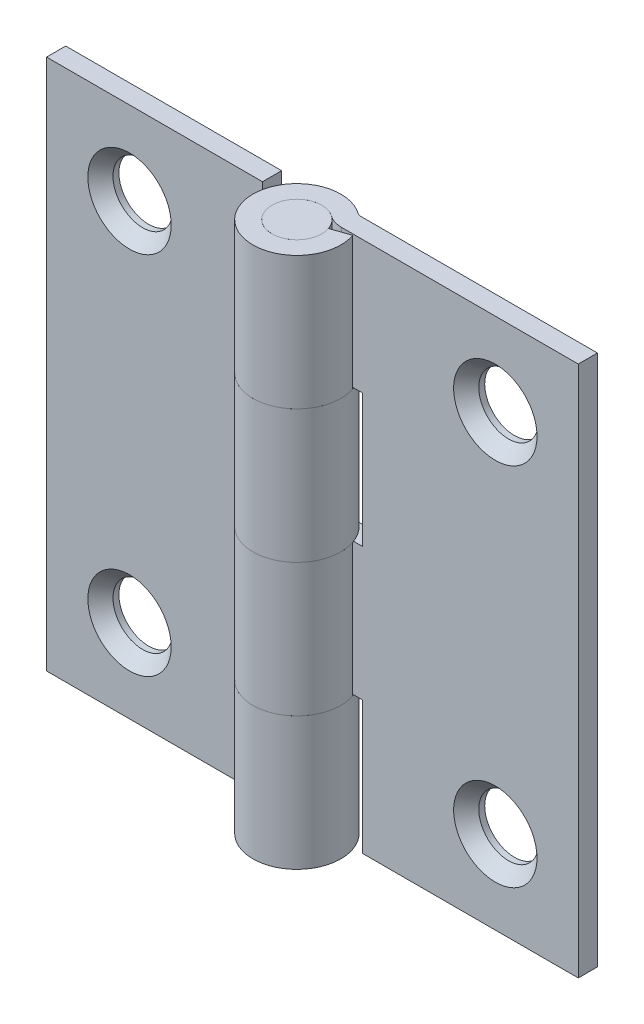
from build123d import *

# Parameters (mm, degrees)
EXTRUDE_THIN1_DEPTH      = 25.4
EXTRUDE_THIN1_DEPTH_BACK = 25.4
EXTRUDE_THIN2_DEPTH      = 25.4
EXTRUDE_THIN2_DEPTH_BACK = 25.4
CUT_EXTRUDE1_START       = -12.7
CUT_EXTRUDE1_DEPTH       = 12.7
LPATTERN1_COUNT          = 2
LPATTERN1_PITCH          = 25.4
CUT_EXTRUDE2_START       = -25.4
CUT_EXTRUDE2_DEPTH       = 12.7
LPATTERN2_COUNT          = 2
LPATTERN2_PITCH          = 25.4
CUT_EXTRUDE3_DEPTH       = 37.16615951
CUT_EXTRUDE3_DEPTH_BACK  = 37.16615951
SKETCH6_R                = 2.8448
BOSS_EXTRUDE1_DEPTH      = 25.4
BOSS_EXTRUDE1_DEPTH_BACK = 25.4
SKETCH7_R                = 2.3749


# Read off the part's stored shape, not the designer's step: Cut-Extrude1
with BuildPart() as part:
    # Sketch3 → Extrude-Thin1 (new, two sides: drawn at the far end of the back side and taken through both)
    with BuildSketch(Plane(origin=(0, 0, 0), x_dir=(1, 0, 0), z_dir=(0, 1, 0)).offset(-EXTRUDE_THIN1_DEPTH_BACK)):
        with BuildLine():
            ThreePointArc((-2.247389762, 0.767716918), (-1.931760974, -1.381466449), (0, -2.3749))
            ThreePointArc((0, -2.3749), (2.3749, 0), (0, 2.3749))
            ThreePointArc((0, 2.3749), (-0.726513266, 2.261045883), (-1.383367576, 1.9304))
            ThreePointArc((-1.383367576, 1.9304), (-2.040221886, 1.599754117), (-2.766735152, 1.4859))
            Line((-2.766735152, 1.4859), (-25.4, 1.4859))
            Line((-25.4, 1.4859), (-25.4, 3.3147))
            Line((-25.4, 3.3147), (-2.766735152, 3.3147))
            ThreePointArc((-2.766735152, 3.3147), (-2.599675952, 3.340880358), (-2.448634586, 3.41691123))
            ThreePointArc((-2.448634586, 3.41691123), (-1.285967331, 4.002172124), (0, 4.2037))
            ThreePointArc((0, 4.2037), (4.2037, 0), (0, -4.2037))
            ThreePointArc((0, -4.2037), (-3.419320226, -2.44526949), (-3.97800006, 1.3589))
            Line((-3.97800006, 1.3589), (-2.247389762, 0.767716918))
        make_face()
    extrude(amount=EXTRUDE_THIN1_DEPTH + EXTRUDE_THIN1_DEPTH_BACK)

    # Cut-Extrude1 outline → Cut-Extrude1 (cut)
    with BuildSketch(Plane(origin=(0, 25.4, 0), x_dir=(1, 0, 0), z_dir=(0, 1, 0)).offset(CUT_EXTRUDE1_START)):
        with BuildLine():
            Line((-2.766735152, 3.3147), (-4.77175006, 3.3147))
            Line((-4.77175006, 3.3147), (-4.77175006, 1.4859))
            Line((-4.77175006, 1.4859), (-2.766735152, 1.4859))
            ThreePointArc((-2.766735152, 1.4859), (-2.040221886, 1.599754117), (-1.383367576, 1.9304))
            ThreePointArc((-1.383367576, 1.9304), (1.906189315, -1.416542378), (-2.247389762, 0.767716918))
            Line((-2.247389762, 0.767716918), (-3.97800006, 1.3589))
            ThreePointArc((-3.97800006, 1.3589), (3.37405702, -2.507355761), (-2.448634586, 3.41691123))
            ThreePointArc((-2.448634586, 3.41691123), (-2.599675952, 3.340880358), (-2.766735152, 3.3147))
        make_face()
    cut_extrude1 = extrude(amount=CUT_EXTRUDE1_DEPTH, mode=Mode.SUBTRACT)

    # LPattern1: Cut-Extrude1 ×2
    with Locations(*[(0, -i * LPATTERN1_PITCH, 0) for i in range(1, LPATTERN1_COUNT)]):
        add(cut_extrude1, mode=Mode.SUBTRACT)


with BuildPart() as body_2:
    # Sketch4 → Extrude-Thin2 (new, two sides: drawn at the far end of the back side and taken through both)
    with BuildSketch(Plane(origin=(0, 0, 0), x_dir=(1, 0, 0), z_dir=(0, 1, 0)).offset(-EXTRUDE_THIN2_DEPTH_BACK)):
        with BuildLine():
            ThreePointArc((2.247389762, 0.767716918), (1.931760974, -1.381466449), (0, -2.3749))
            ThreePointArc((0, -2.3749), (-2.3749, 0), (0, 2.3749))
            ThreePointArc((0, 2.3749), (0.726513266, 2.261045883), (1.383367576, 1.9304))
            ThreePointArc((1.383367576, 1.9304), (2.040221886, 1.599754117), (2.766735152, 1.4859))
            Line((2.766735152, 1.4859), (25.4, 1.4859))
            Line((25.4, 1.4859), (25.4, 3.3147))
            Line((25.4, 3.3147), (2.766735152, 3.3147))
            ThreePointArc((2.766735152, 3.3147), (2.599675952, 3.340880358), (2.448634586, 3.41691123))
            ThreePointArc((2.448634586, 3.41691123), (1.285967331, 4.002172124), (0, 4.2037))
            ThreePointArc((0, 4.2037), (-4.2037, 0), (0, -4.2037))
            ThreePointArc((0, -4.2037), (3.419320226, -2.44526949), (3.97800006, 1.3589))
            Line((3.97800006, 1.3589), (2.247389762, 0.767716918))
        make_face()
    extrude(amount=EXTRUDE_THIN2_DEPTH + EXTRUDE_THIN2_DEPTH_BACK)

    # Sketch5<2> → Cut-Extrude2 (cut)
    with BuildSketch(Plane(origin=(0, 25.4, 0), x_dir=(1, 0, 0), z_dir=(0, 1, 0)).offset(CUT_EXTRUDE2_START)):
        with BuildLine():
            Line((-3.97800006, 3.3147), (-2.766735152, 3.3147))
            ThreePointArc((-2.766735152, 3.3147), (-2.599675952, 3.340880358), (-2.448634586, 3.41691123))
            ThreePointArc((-2.448634586, 3.41691123), (0, 4.2037), (2.448634586, 3.41691123))
            ThreePointArc((2.448634586, 3.41691123), (2.599675952, 3.340880358), (2.766735152, 3.3147))
            Line((2.766735152, 3.3147), (3.97800006, 3.3147))
            Line((3.97800006, 3.3147), (4.77175006, 3.3147))
            Line((4.77175006, 3.3147), (4.77175006, 1.4859))
            Line((4.77175006, 1.4859), (3.97800006, 1.4859))
            Line((3.97800006, 1.4859), (3.97800006, 1.3589))
            ThreePointArc((3.97800006, 1.3589), (0, -4.2037), (-3.97800006, 1.3589))
            Line((-3.97800006, 1.3589), (-3.97800006, 1.4859))
            Line((-3.97800006, 1.4859), (-4.77175006, 1.4859))
            Line((-4.77175006, 1.4859), (-4.77175006, 3.3147))
            Line((-4.77175006, 3.3147), (-3.97800006, 3.3147))
        make_face()
    cut_extrude2 = extrude(amount=CUT_EXTRUDE2_DEPTH, mode=Mode.SUBTRACT)

    # LPattern2: Cut-Extrude2 ×2
    with Locations(*[(0, -i * LPATTERN2_PITCH, 0) for i in range(1, LPATTERN2_COUNT)]):
        add(cut_extrude2, mode=Mode.SUBTRACT)


with BuildPart() as cut_extrude3_tool:
    # Sketch6 → Cut-Extrude3 (new, two sides: drawn at the far end of the back side and taken through both)
    with BuildSketch(Plane.XY.offset(-CUT_EXTRUDE3_DEPTH_BACK)):
        with Locations((-17.4752, 17.4498)):
            Circle(SKETCH6_R)
        with Locations((-17.4752, -17.4498)):
            Circle(SKETCH6_R)
        with Locations(Location((17.4752, -17.4498, 0), (0, 0, 180))):
            Circle(SKETCH6_R)
        with Locations(Location((17.4752, 17.4498, 0), (0, 0, 180))):
            Circle(SKETCH6_R)
    extrude(amount=CUT_EXTRUDE3_DEPTH + CUT_EXTRUDE3_DEPTH_BACK)


with BuildPart() as part_1:
    add(part.part)

    # Cut-Extrude3: cut by cut_extrude3_tool
    add(cut_extrude3_tool.part, mode=Mode.SUBTRACT)

    # Cut-Extrude4 cone 3 section (through the dimple's axis) → Cut-Extrude4 cone 3 (revolve, cut)
    with BuildSketch(Plane(origin=(-17.4752, -17.4498, -1.4859), x_dir=(0, -1, 0), z_dir=(1, 0, 0))):
        Polygon((0, 0), (3.98272, 0), (0, 4.423258675), align=None)
    revolve(axis=Axis((-17.4752, -17.4498, -1.4859), (0, 0, -1)), mode=Mode.SUBTRACT)

    # Cut-Extrude4 cone 4 section (through the dimple's axis) → Cut-Extrude4 cone 4 (revolve, cut)
    with BuildSketch(Plane(origin=(-17.4752, 17.4498, -1.4859), x_dir=(0, -1, 0), z_dir=(1, 0, 0))):
        Polygon((0, 0), (3.98272, 0), (0, 4.423258675), align=None)
    revolve(axis=Axis((-17.4752, 17.4498, -1.4859), (0, 0, -1)), mode=Mode.SUBTRACT)


with BuildPart() as body_2_1:
    add(body_2.part)

    # Cut-Extrude3: cut by cut_extrude3_tool
    add(cut_extrude3_tool.part, mode=Mode.SUBTRACT)

    # Cut-Extrude4 cone 1 section (through the dimple's axis) → Cut-Extrude4 (revolve, cut)
    with BuildSketch(Plane(origin=(17.4752, 17.4498, -1.4859), x_dir=(0, -1, 0), z_dir=(1, 0, 0))):
        Polygon((0, 0), (3.98272, 0), (0, 4.423258675), align=None)
    revolve(axis=Axis((17.4752, 17.4498, -1.4859), (0, 0, -1)), mode=Mode.SUBTRACT)

    # Cut-Extrude4 cone 2 section (through the dimple's axis) → Cut-Extrude4 cone 2 (revolve, cut)
    with BuildSketch(Plane(origin=(17.4752, -17.4498, -1.4859), x_dir=(0, -1, 0), z_dir=(1, 0, 0))):
        Polygon((0, 0), (3.98272, 0), (0, 4.423258675), align=None)
    revolve(axis=Axis((17.4752, -17.4498, -1.4859), (0, 0, -1)), mode=Mode.SUBTRACT)


with BuildPart() as body_3:
    # Sketch7 → Boss-Extrude1 (new, two sides: drawn at the far end of the back side and taken through both)
    with BuildSketch(Plane(origin=(0, 0, 0), x_dir=(1, 0, 0), z_dir=(0, 1, 0)).offset(-BOSS_EXTRUDE1_DEPTH_BACK)):
        with Locations(Location((0, 0, 0), (0, 0, 270))):
            Circle(SKETCH7_R)
    extrude(amount=BOSS_EXTRUDE1_DEPTH + BOSS_EXTRUDE1_DEPTH_BACK)


solid = Compound([part_1.part, body_2_1.part, body_3.part])
